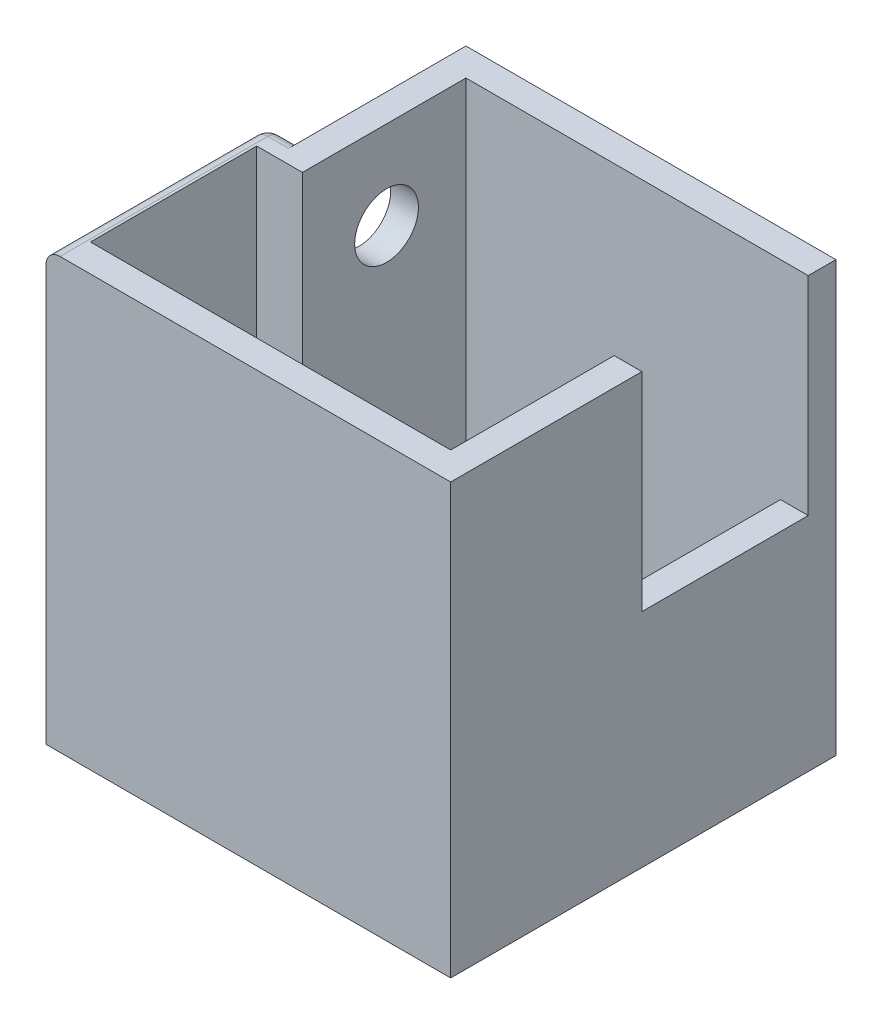
from build123d import *

# Parameters (mm, degrees)
ESQUISSE1_W             = 30
ESQUISSE1_H             = 31
BOSS_EXTRU_1_DEPTH      = 27.8
COQUE1_T                = -2
ENL_V_MAT_EXTRU_1_REACH = 53.321
ESQUISSE2_W             = 12
ESQUISSE2_H             = 15
ENL_V_MAT_EXTRU_2_REACH = 52.138
ESQUISSE3_W             = 15
ESQUISSE3_H             = 12
ESQUISSE4_W             = 26
ESQUISSE4_H             = 11.8
BOSS_EXTRU_2_DEPTH      = 1.5
ESQUISSE5_W             = 11.8
ESQUISSE5_H             = 27.5
BOSS_EXTRU_3_DEPTH      = 3.3
ESQUISSE6_W             = 2.1
ESQUISSE6_H             = 12
BOSS_EXTRU_4_DEPTH      = 6.3
ESQUISSE8_W             = 11.8
ESQUISSE8_H             = 31
ENL_V_MAT_EXTRU_3_DEPTH = 3.3
ENL_V_MAT_EXTRU_4_REACH = 51.464
ESQUISSE10_R            = 2.3
ENL_V_MAT_EXTRU_5_REACH = 53.321
ESQUISSE14_W            = 0.8
ESQUISSE14_H            = 16
CONG_2_R                = 1
CONG_3_R                = 1
ENL_V_MAT_EXTRU_6_REACH = 52.857
ESQUISSE15_W            = 8
ESQUISSE15_H            = 2.1


with BuildPart() as part:
    # Esquisse1 → Boss.-Extru.1 (new body)
    with BuildSketch(Plane.XY):
        with Locations((15, 15.5)):
            Rectangle(ESQUISSE1_W, ESQUISSE1_H)
    extrude(amount=BOSS_EXTRU_1_DEPTH)

    # Coque1
    coque1_openings = [part.faces().sort_by_distance(p)[0] for p in [
        (15, 31, 13.9),
    ]]
    offset(amount=COQUE1_T, openings=coque1_openings, kind=Kind.INTERSECTION)

    # Esquisse2 → Enlèv. mat.-Extru.1 (cut, up to next)
    with BuildSketch(Plane(origin=(30, 0, 0), x_dir=(0, 0, -1), z_dir=(1, 0, 0)), mode=Mode.PRIVATE) as enl_v_mat_extru_1_sk1:
        with Locations((-8, 23.5)):
            Rectangle(ESQUISSE2_W, ESQUISSE2_H)
    enl_v_mat_extru_1_tool1 = extrude(enl_v_mat_extru_1_sk1.sketch, amount=-ENL_V_MAT_EXTRU_1_REACH, mode=Mode.PRIVATE) & part.part
    add(enl_v_mat_extru_1_tool1.solids().sort_by_distance((30, 23.5, 8))[0], mode=Mode.SUBTRACT)

    # Esquisse3 → Enlèv. mat.-Extru.2 (cut, up to next)
    with BuildSketch(Plane(origin=(0, 2, 0), x_dir=(1, 0, 0), z_dir=(0, 1, 0)), mode=Mode.PRIVATE) as enl_v_mat_extru_2_sk1:
        with Locations((11.6, -19.8)):
            Rectangle(ESQUISSE3_W, ESQUISSE3_H)
    enl_v_mat_extru_2_tool1 = extrude(enl_v_mat_extru_2_sk1.sketch, amount=-ENL_V_MAT_EXTRU_2_REACH, mode=Mode.PRIVATE) & part.part
    add(enl_v_mat_extru_2_tool1.solids().sort_by_distance((11.6, 2, 19.8))[0], mode=Mode.SUBTRACT)

    # Esquisse4 → Boss.-Extru.2 (add)
    with BuildSketch(Plane(origin=(0, 2, 0), x_dir=(1, 0, 0), z_dir=(0, 1, 0))):
        with Locations((15, -7.9)):
            Rectangle(ESQUISSE4_W, ESQUISSE4_H)
    extrude(amount=BOSS_EXTRU_2_DEPTH)

    # Esquisse5 → Boss.-Extru.3 (add)
    with BuildSketch(Plane(origin=(2, 0, 0), x_dir=(0, 0, -1), z_dir=(1, 0, 0))):
        with Locations((-7.9, 17.25)):
            Rectangle(ESQUISSE5_W, ESQUISSE5_H)
    extrude(amount=BOSS_EXTRU_3_DEPTH)

    # Esquisse6 → Boss.-Extru.4 (add)
    with BuildSketch(Plane(origin=(0, 2, 0), x_dir=(1, 0, 0), z_dir=(0, 1, 0))):
        with Locations((3.05, -19.8)):
            Rectangle(ESQUISSE6_W, ESQUISSE6_H)
    extrude(amount=BOSS_EXTRU_4_DEPTH)

    # Esquisse8 → Enlèv. mat.-Extru.3 (cut)
    with BuildSketch(Plane.ZY):
        with Locations((5.9, 15.5)):
            Rectangle(ESQUISSE8_W, ESQUISSE8_H)
    extrude(amount=-ENL_V_MAT_EXTRU_3_DEPTH, mode=Mode.SUBTRACT)

    # Esquisse10 → Enlèv. mat.-Extru.4 (cut, up to next)
    with BuildSketch(Plane.ZY.offset(-3.3), mode=Mode.PRIVATE) as enl_v_mat_extru_4_sk1:
        with Locations((7.73, 24.64)):
            Circle(ESQUISSE10_R)
    enl_v_mat_extru_4_tool1 = extrude(enl_v_mat_extru_4_sk1.sketch, amount=-ENL_V_MAT_EXTRU_4_REACH, mode=Mode.PRIVATE) & part.part
    add(enl_v_mat_extru_4_tool1.solids().sort_by_distance((3.3, 24.64, 7.73))[0], mode=Mode.SUBTRACT)

    # Esquisse14 → Enlèv. mat.-Extru.5 (cut, up to next)
    with BuildSketch(Plane(origin=(0, 31, 0), x_dir=(1, 0, 0), z_dir=(0, 1, 0)), mode=Mode.PRIVATE) as enl_v_mat_extru_5_sk1:
        with Locations((0.4, -19.8)):
            Rectangle(ESQUISSE14_W, ESQUISSE14_H)
    enl_v_mat_extru_5_tool1 = extrude(enl_v_mat_extru_5_sk1.sketch, amount=-ENL_V_MAT_EXTRU_5_REACH, mode=Mode.PRIVATE) & part.part
    add(enl_v_mat_extru_5_tool1.solids().sort_by_distance((0.4, 31, 19.8))[0], mode=Mode.SUBTRACT)

    # Congé2
    cong_2_edges = [part.edges().sort_by_distance(p)[0] for p in [
        (2.05, 31, 11.8),
    ]]
    fillet(cong_2_edges, radius=CONG_2_R)

    # Congé3
    cong_3_edges = [part.edges().sort_by_distance(p)[0] for p in [
        (0.8, 15, 11.8),
        (0.8, 30.707106781, 12.092893219),
        (0.8, 31, 20.3),
    ]]
    fillet(cong_3_edges, radius=CONG_3_R)

    # Esquisse15 → Enlèv. mat.-Extru.6 (cut, up to next)
    with BuildSketch(Plane.ZY.offset(-0.8), mode=Mode.PRIVATE) as enl_v_mat_extru_6_sk1:
        with Locations((20.3, 19.6)):
            Rectangle(ESQUISSE15_W, ESQUISSE15_H)
    enl_v_mat_extru_6_tool1 = extrude(enl_v_mat_extru_6_sk1.sketch, amount=-ENL_V_MAT_EXTRU_6_REACH, mode=Mode.PRIVATE) & part.part
    add(enl_v_mat_extru_6_tool1.solids().sort_by_distance((0.8, 19.6, 20.3))[0], mode=Mode.SUBTRACT)


solid = part.part
